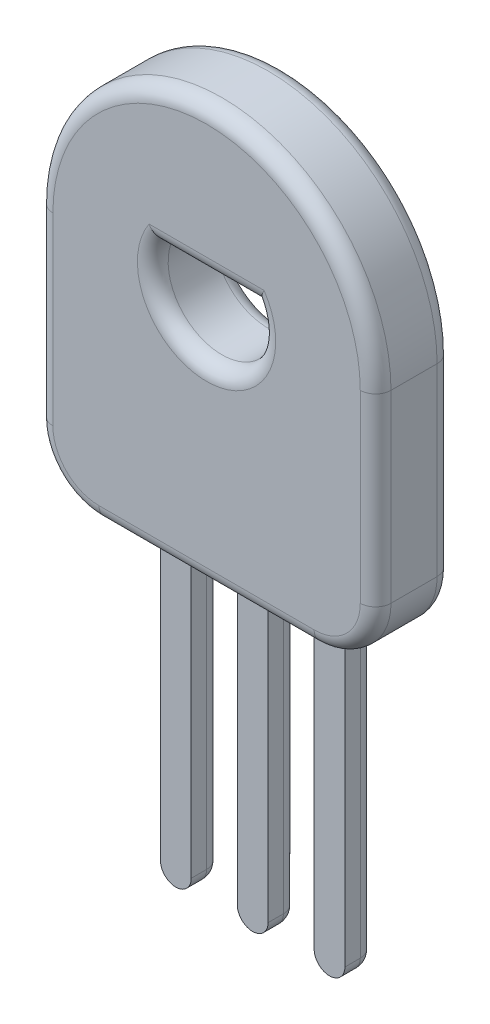
from build123d import *

# Parameters (mm, degrees)
BOSS_EXTRUDE1_DEPTH = 2.5
BOSS_EXTRUDE2_DEPTH = 1
FILLET1_R           = 2
FILLET2_R           = 0.5


with BuildPart() as part:
    # Sketch1 → Boss-Extrude1 (new body)
    with BuildSketch(Plane.XY):
        with BuildLine():
            Line((5.5, 0), (5.5, -8))
            Line((5.5, -8), (-5.5, -8))
            Line((-5.5, -8), (-5.5, 0))
            ThreePointArc((-5.5, 0), (0, 5.5), (5.5, 0))
        make_face()
        with BuildLine():
            ThreePointArc((-1.58113883, 0.75), (0, -1.75), (1.58113883, 0.75))
            Line((1.58113883, 0.75), (-1.58113883, 0.75))
        make_face(mode=Mode.SUBTRACT)
    extrude(amount=BOSS_EXTRUDE1_DEPTH)

    # Sketch1<3> → Boss-Extrude2 (add)
    with BuildSketch(Plane.XY):
        with BuildLine():
            Line((-2, -8), (-3, -8))
            Line((-3, -8), (-3, -18))
            ThreePointArc((-3, -18), (-2.5, -18.5), (-2, -18))
            Line((-2, -18), (-2, -8))
        make_face()
        with BuildLine():
            Line((0.5, -8), (-0.5, -8))
            Line((-0.5, -8), (-0.5, -18))
            ThreePointArc((-0.5, -18), (0, -18.5), (0.5, -18))
            Line((0.5, -18), (0.5, -8))
        make_face()
        with BuildLine():
            Line((3, -18), (3, -8))
            Line((3, -8), (2, -8))
            Line((2, -8), (2, -18))
            ThreePointArc((2, -18), (2.5, -18.5), (3, -18))
        make_face()
    extrude(amount=BOSS_EXTRUDE2_DEPTH)

    # Fillet1
    fillet1_edges = [part.edges().sort_by_distance(p)[0] for p in [
        (5.5, -8, 1.25),
        (-5.5, -8, 1.25),
    ]]
    fillet(fillet1_edges, radius=FILLET1_R)

    # Fillet2
    fillet2_edges = [part.edges().sort_by_distance(p)[0] for p in [
        (0, 0.75, 2.5),
        (0, -1.75, 0),
        (5.5, -3, 2.5),
        (0, 5.5, 2.5),
        (-3.25, -8, 0),
        (-3, -13, 0),
        (-5.5, -3, 2.5),
        (-2.5, -18.5, 0),
        (-2, -13, 0),
        (-1.25, -8, 0),
        (-0.5, -13, 0),
        (0, -18.5, 0),
        (0.5, -13, 0),
        (1.25, -8, 0),
        (2, -13, 0),
        (2.5, -18.5, 0),
        (3, -13, 0),
        (3.25, -8, 0),
        (-4.914213562, -7.414213562, 0),
        (4.914213562, -7.414213562, 0),
        (0, -8, 2.5),
        (0, -1.75, 2.5),
        (-4.914213562, -7.414213562, 2.5),
        (4.914213562, -7.414213562, 2.5),
        (-5.5, -3, 0),
        (0, 5.5, 0),
        (5.5, -3, 0),
        (0, 0.75, 0),
    ]]
    fillet(fillet2_edges, radius=FILLET2_R - 0.0001)  # a hair under: the kernel refuses the full size


solid = part.part
